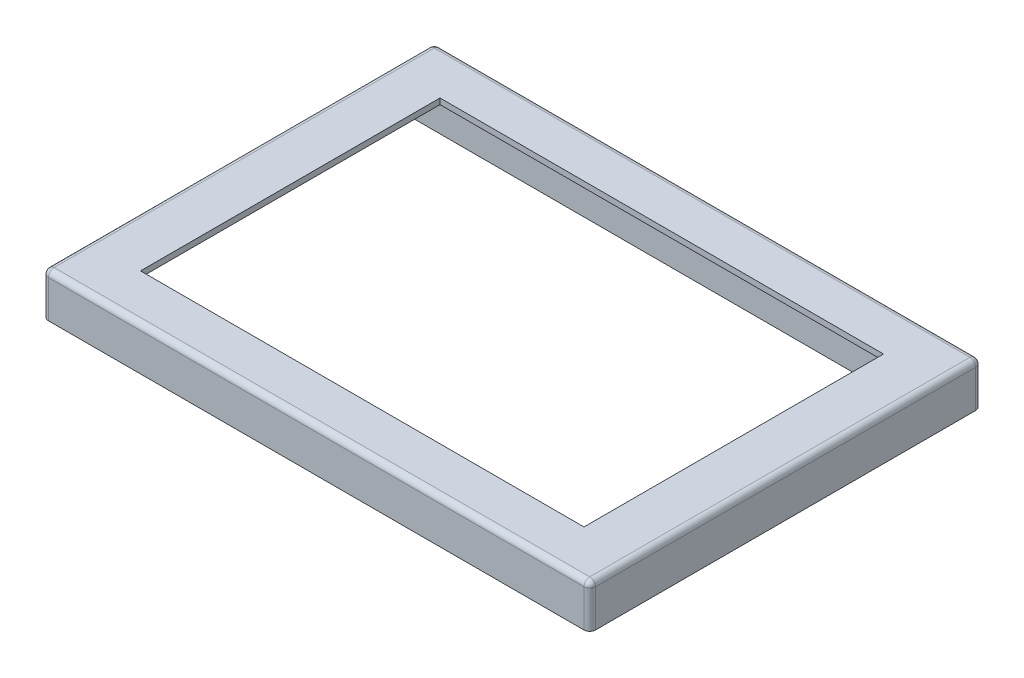
from build123d import *

# Parameters (mm, degrees)
SKETCH_1_W          = 95
SKETCH_1_H          = 68
EXTRUDE_1_DEPTH     = 7.5
CUT_EXTRUDE_1_DEPTH = 6.5
SKETCH_3_W          = 77
SKETCH_3_H          = 52
CUT_EXTRUDE_2_DEPTH = 59.893972527
SKETCH_4_R          = 2.1
CUT_EXTRUDE_3_DEPTH = 2.6
FILLET_1_R          = 1
FILLET_2_R          = 1


with BuildPart() as part:
    # 草图1 → 凸台-拉伸1 (new body)
    with BuildSketch(Plane(origin=(0, 0, 0), x_dir=(1, 0, 0), z_dir=(0, 1, 0))):
        Rectangle(SKETCH_1_W, SKETCH_1_H)
    extrude(amount=EXTRUDE_1_DEPTH)

    # 草图2 → 切除-拉伸1 (cut)
    with BuildSketch(Plane.XZ):
        Polygon((-45.5, 28.1), (40.5, 28.1), (40.5, -28.1), (-45.5, -28.1), (-45.5, -18), (-46, -18), (-46, 25), (-45.5, 25), align=None)
    extrude(amount=-CUT_EXTRUDE_1_DEPTH, mode=Mode.SUBTRACT)

    # 草图3 → 切除-拉伸2 (cut, through all)
    with BuildSketch(Plane(origin=(0, 7.5, 0), x_dir=(1, 0, 0), z_dir=(0, 1, 0))):
        Rectangle(SKETCH_3_W, SKETCH_3_H)
    extrude(amount=-CUT_EXTRUDE_2_DEPTH, mode=Mode.SUBTRACT)

    # 草图4 → 切除-拉伸3 (cut)
    with BuildSketch(Plane.XZ):
        with Locations(Location((-44.5, 31, 0), (0, 0, 270))):
            Circle(SKETCH_4_R)
        with Locations(Location((0, 31, 0), (0, 0, 270))):
            Circle(SKETCH_4_R)
        with Locations(Location((44.5, 31, 0), (0, 0, 270))):
            Circle(SKETCH_4_R)
        with Locations(Location((44.5, -31, 0), (0, 0, 270))):
            Circle(SKETCH_4_R)
        with Locations(Location((0, -31, 0), (0, 0, 270))):
            Circle(SKETCH_4_R)
        with Locations(Location((-44.5, -31, 0), (0, 0, 270))):
            Circle(SKETCH_4_R)
    extrude(amount=-CUT_EXTRUDE_3_DEPTH, mode=Mode.SUBTRACT)

    # 圆角1
    fillet_1_edges = [part.edges().sort_by_distance(p)[0] for p in [
        (-47.5, 7.5, 0),
        (0, 7.5, 34),
        (47.5, 7.5, 0),
        (0, 7.5, -34),
    ]]
    fillet(fillet_1_edges, radius=FILLET_1_R)

    # 圆角2
    # the kernel refuses this fillet: 1 mm, written as the material it takes off along each edge
    with BuildSketch(Plane(origin=(46.5, 6.5, -33), x_dir=(0, 0, -1), z_dir=(1, 0, 0))) as fillet_2_piece_1_section:
        Polygon((0, 0), (FILLET_2_R, 0), (FILLET_2_R, FILLET_2_R), (0, FILLET_2_R), align=None)
    fillet_2_piece_1 = extrude(amount=FILLET_2_R, mode=Mode.PRIVATE)
    fillet_2_piece_1 = fillet_2_piece_1 - Plane(origin=(46.5, 6.5, -33), x_dir=(0, -0.7071067811865475, 0.7071067811865475), z_dir=(1, 0, 0)) * Sphere(FILLET_2_R, mode=Mode.PRIVATE)
    add(fillet_2_piece_1, mode=Mode.SUBTRACT)
    with BuildSketch(Plane(origin=(46.5, 6.5, 33), x_dir=(1, 0, 0), z_dir=(0, 0, 1))) as fillet_2_piece_2_section:
        Polygon((0, 0), (FILLET_2_R, 0), (FILLET_2_R, FILLET_2_R), (0, FILLET_2_R), align=None)
    fillet_2_piece_2 = extrude(amount=FILLET_2_R, mode=Mode.PRIVATE)
    fillet_2_piece_2 = fillet_2_piece_2 - Plane(origin=(46.5, 6.5, 33), x_dir=(-0.7071067811865475, -0.7071067811865475, 0), z_dir=(0, 0, 1)) * Sphere(FILLET_2_R, mode=Mode.PRIVATE)
    add(fillet_2_piece_2, mode=Mode.SUBTRACT)
    with BuildSketch(Plane(origin=(-46.5, 6.5, -33), x_dir=(0, 0, -1), z_dir=(-1, 0, 0))) as fillet_2_piece_3_section:
        Polygon((0, 0), (FILLET_2_R, 0), (FILLET_2_R, -FILLET_2_R), (0, -FILLET_2_R), align=None)
    fillet_2_piece_3 = extrude(amount=FILLET_2_R, mode=Mode.PRIVATE)
    fillet_2_piece_3 = fillet_2_piece_3 - Plane(origin=(-46.5, 6.5, -33), x_dir=(0, -0.7071067811865475, 0.7071067811865475), z_dir=(-1, 0, 0)) * Sphere(FILLET_2_R, mode=Mode.PRIVATE)
    add(fillet_2_piece_3, mode=Mode.SUBTRACT)
    with BuildSketch(Plane(origin=(-46.5, 6.5, 33), x_dir=(-1, 0, 0), z_dir=(0, 0, 1))) as fillet_2_piece_4_section:
        Polygon((0, 0), (FILLET_2_R, 0), (FILLET_2_R, -FILLET_2_R), (0, -FILLET_2_R), align=None)
    fillet_2_piece_4 = extrude(amount=FILLET_2_R, mode=Mode.PRIVATE)
    fillet_2_piece_4 = fillet_2_piece_4 - Plane(origin=(-46.5, 6.5, 33), x_dir=(0.7071067811865475, -0.7071067811865475, 0), z_dir=(0, 0, 1)) * Sphere(FILLET_2_R, mode=Mode.PRIVATE)
    add(fillet_2_piece_4, mode=Mode.SUBTRACT)
    with BuildSketch(Plane(origin=(-47.5, -2.5, 34), x_dir=(1, 0, 0), z_dir=(0, 1, 0)), Plane(origin=(-47.5, -2.5, -34), x_dir=(0, 0, 1), z_dir=(0, 1, 0))) as fillet_2_piece_5:
        with BuildLine():
            CenterArc((FILLET_2_R, FILLET_2_R), FILLET_2_R, 180, 90)
            Line((0, FILLET_2_R), (0, 0))
            Line((0, 0), (FILLET_2_R, 0))
        make_face()
    extrude(amount=9, mode=Mode.SUBTRACT)
    with BuildSketch(Plane(origin=(47.5, -2.5, -34), x_dir=(0, 0, 1), z_dir=(0, 1, 0)), Plane(origin=(47.5, -2.5, 34), x_dir=(-1, 0, 0), z_dir=(0, 1, 0))) as fillet_2_piece_6:
        with BuildLine():
            CenterArc((FILLET_2_R, -FILLET_2_R), FILLET_2_R, 90, 90)
            Line((0, -FILLET_2_R), (0, 0))
            Line((0, 0), (FILLET_2_R, 0))
        make_face()
    extrude(amount=9, mode=Mode.SUBTRACT)


solid = part.part
